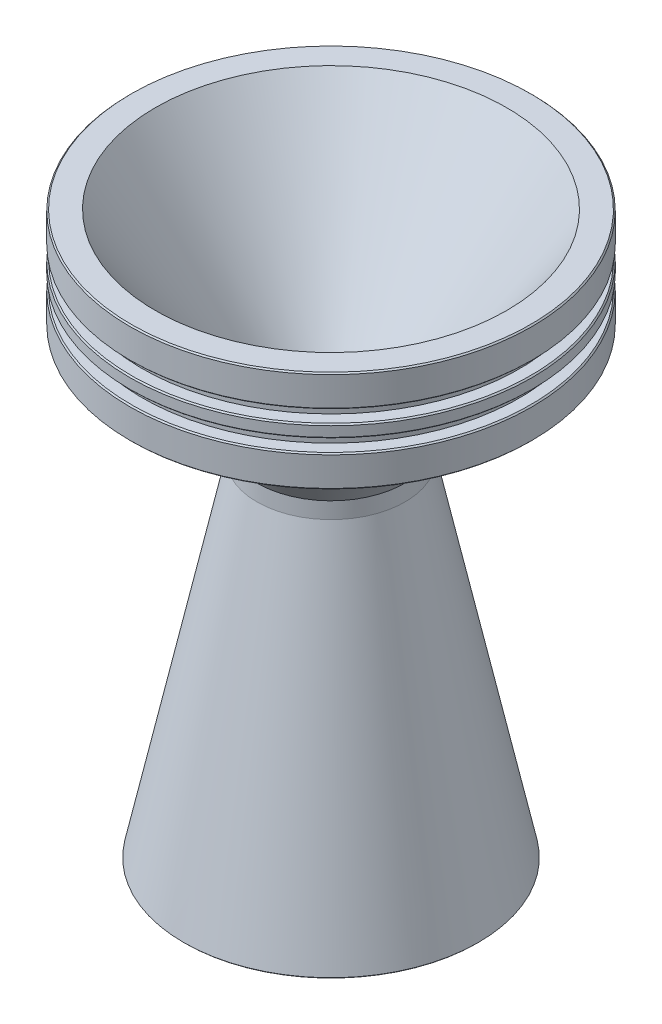
from build123d import *
from OCP.BRepFilletAPI import BRepFilletAPI_MakeChamfer

# Parameters (mm, degrees)
OUTER_CHAMFERS_SIZE  = 0.127
OUTER_CHAMFERS_SIZE2 = 0.107077278


with BuildPart() as part:
    # Sketch1 → base_revolve (revolve)
    with BuildSketch(Plane.XY):
        Polygon((0, 0), (2.54, 0), (16.002, -19.225728467), (16.002, -21.765728467), (8.615814322, -56.515), (5.369882934, -56.515), (12.756068611, -21.765728467), (12.756068611, -20.1255016), (5.778149269, -10.16), (0, -10.16), (0, -6.985), (1.27, -6.985), (1.27, -5.715), (0, -5.715), (0, -4.445), (1.27, -4.445), (1.27, -3.175), (0, -3.175), align=None)
    revolve(axis=Axis((20.193, 0, 0), (0, -1, 0)))

    # outer_chamfers: one chamfer whose edges measure the first distance from different faces: ONE call of the kernel's chamfer builder (chamfer() names one face for all edges)
    outer_chamfers_edges_1 = [part.edges().sort_by_distance(p)[0] for p in [
        (40.386, -10.16, 0),
        (40.386, 0, 0),
        (40.386, -5.715, 0),
        (40.386, -6.985, 0),
        (40.386, -4.445, 0),
        (40.386, -3.175, 0),
    ]]
    outer_chamfers_edges_2 = [part.edges().sort_by_distance(p)[0] for p in [
        (35.016117066, -56.515, 0),
    ]]
    outer_chamfers_side_2 = [part.faces().sort_by_distance(p)[0] for p in [
        (32.189446741, -56.515, 0),
    ]]
    outer_chamfers = BRepFilletAPI_MakeChamfer(part.part.solid().wrapped)
    for e in outer_chamfers_edges_1:
        outer_chamfers.Add(OUTER_CHAMFERS_SIZE, e.wrapped)
    for e in outer_chamfers_edges_2:
        outer_chamfers.Add(OUTER_CHAMFERS_SIZE, OUTER_CHAMFERS_SIZE2, e.wrapped, outer_chamfers_side_2[0].wrapped)  # the first distance lies on this face
    add(Compound.cast(outer_chamfers.Shape()), mode=Mode.REPLACE)


solid = part.part
